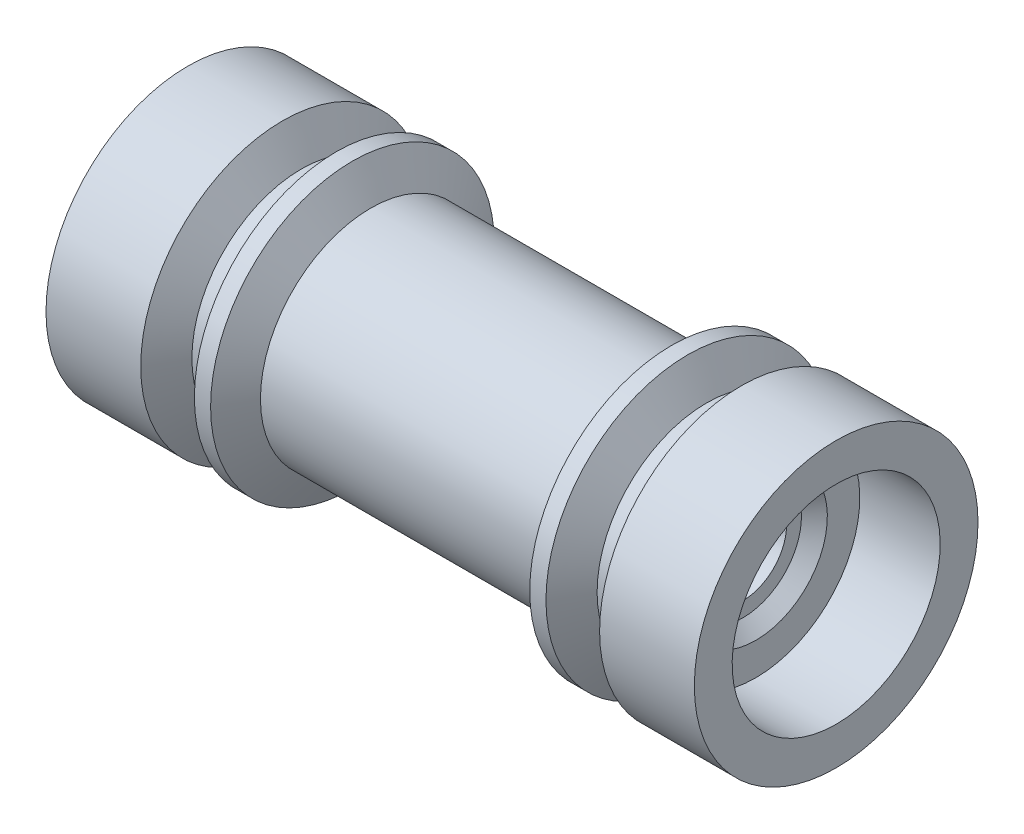
from build123d import *

# Parameters (mm, degrees)
CHAMFER1_SIZE = 0.508


with BuildPart() as part:
    # Sketch2 → Revolve1 (revolve)
    with BuildSketch(Plane.XY):
        Polygon((-8.988234842, 5.55625), (-12.7, 5.55625), (-12.7, 4.075), (-9.55, 4.075), (-9.55, 2.805), (-9.042, 2.297), (-9.042, 1.7145), (-2.875, 1.7145), (-2.875, 1.6), (0, 1.6), (0, 4.318), (-5.536861187, 4.318), (-6.251765158, 5.55625), (-6.886765158, 5.55625), (-7.62, 4.28625), (-8.255, 4.28625), align=None)
    revolve(axis=Axis((-12.7, 0, 0), (1, 0, 0)))

    # Mirror1: part across plane


with BuildPart() as part_1:
    add(part.part)
    add(part.part.mirror(Plane(origin=(0, 0, 0), x_dir=(0, 0, 1), z_dir=(1, 0, 0))))

    # Chamfer1
    chamfer1_edges = [part_1.edges().sort_by_distance(p)[0] for p in [
        (-12.7, -4.075, 0),
    ]]
    chamfer(chamfer1_edges, length=CHAMFER1_SIZE)


solid = part_1.part
